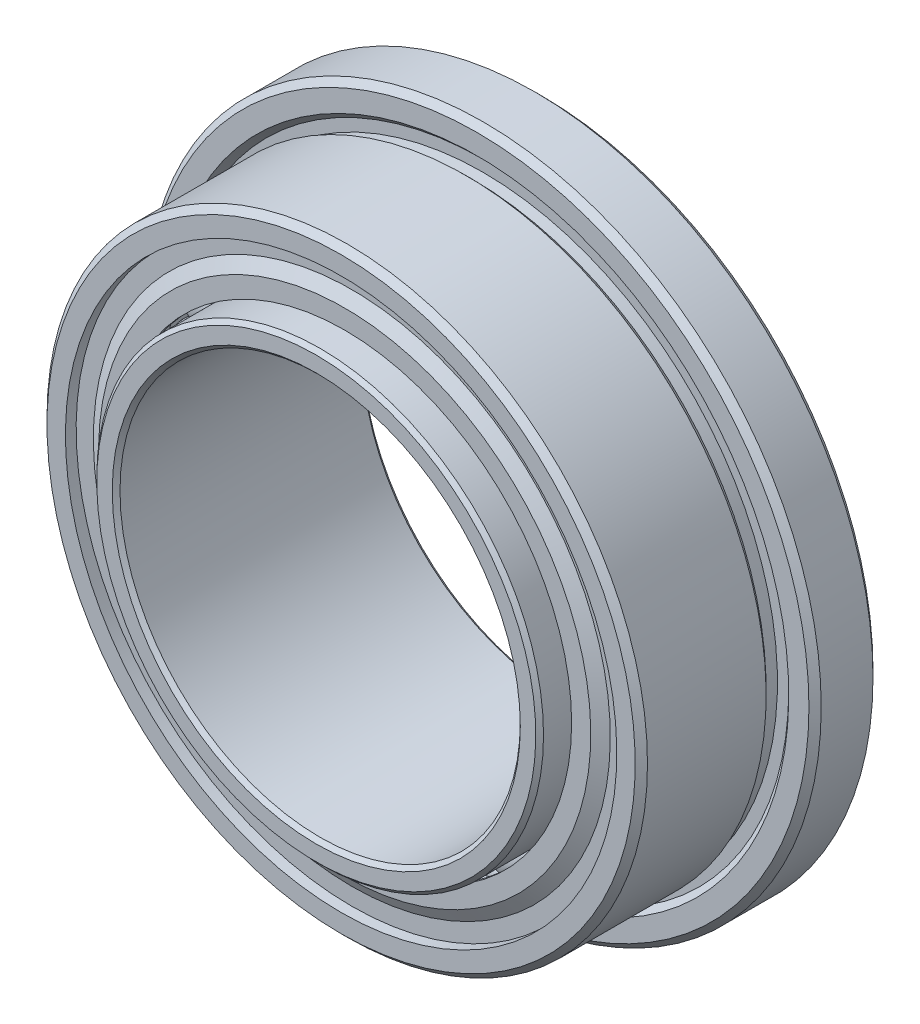
from build123d import *

# Parameters (mm, degrees)
FILLET1_SIZE      = 0.097366667
FILLET2_SIZE      = 0.061383333
CIRPATTERN3_COUNT = 27
SKETCH8_W         = 0.226785714
SKETCH8_H         = 0.194733333


with BuildPart() as part:
    # Sketch2 → Revolve1 (revolve)
    with BuildSketch(Plane(origin=(0, 0, 0), x_dir=(0, 0, -1), z_dir=(1, 0, 0))):
        with BuildLine():
            Line((1.5875, 5.3594), (0.5715, 5.3594))
            Line((0.5715, 5.3594), (0.5715, 4.942105122))
            Line((0.5715, 4.942105122), (0.661302561, 4.852302561))
            Line((0.661302561, 4.852302561), (0.661302561, 4.672697439))
            Line((0.661302561, 4.672697439), (0.481697439, 4.672697439))
            Line((0.481697439, 4.672697439), (0.391894878, 4.7625))
            Line((0.391894878, 4.7625), (-1.5875, 4.7625))
            Line((-1.5875, 4.7625), (-1.5875, 4.1783))
            Line((-1.5875, 4.1783), (-0.238125, 4.1783))
            ThreePointArc((-0.238125, 4.1783), (0, 4.257675), (0.238125, 4.1783))
            Line((0.238125, 4.1783), (1.5875, 4.1783))
            Line((1.5875, 4.1783), (1.5875, 5.3594))
        make_face()
        with BuildLine():
            Line((1.9812, 3.175), (-1.9812, 3.175))
            Line((-1.9812, 3.175), (-1.9812, 3.5433))
            Line((-1.9812, 3.5433), (-0.238125, 3.5433))
            ThreePointArc((-0.238125, 3.5433), (0, 3.463925), (0.238125, 3.5433))
            Line((0.238125, 3.5433), (1.9812, 3.5433))
            Line((1.9812, 3.5433), (1.9812, 3.175))
        make_face()
    revolve(axis=Axis((0, 0, 0), (0, 0, -1)))

    # Fillet1
    fillet1_edges = [part.edges().sort_by_distance(p)[0] for p in [
        (0, -5.3594, -1.5875),
        (0, -5.3594, -0.5715),
        (0, -4.7625, 1.5875),
    ]]
    chamfer(fillet1_edges, length=FILLET1_SIZE)

    # Fillet2
    fillet2_edges = [part.edges().sort_by_distance(p)[0] for p in [
        (0, -3.5433, -1.9812),
        (0, -3.175, -1.9812),
        (0, -3.5433, 1.9812),
        (0, -3.175, 1.9812),
    ]]
    chamfer(fillet2_edges, length=FILLET2_SIZE)

    # Sketch8 → Cut-Revolve1 (revolve, cut)
    with BuildSketch(Plane(origin=(0, 0, 0), x_dir=(0, 0, -1), z_dir=(1, 0, 0))):
        with Locations((-1.474107143, 4.275666667)):
            Rectangle(SKETCH8_W, SKETCH8_H)
        with Locations((1.474107143, 4.275666667)):
            Rectangle(SKETCH8_W, SKETCH8_H)
    revolve(axis=Axis((0, 0, 0), (0, 0, -1)), mode=Mode.SUBTRACT)


with BuildPart() as body_2:
    # Sketch7 → Revolve3 (revolve)
    with BuildSketch(Plane.XY):
        with BuildLine():
            Line((0, 4.257675), (0, 3.463925))
            ThreePointArc((0, 3.463925), (-0.396875, 3.8608), (0, 4.257675))
        make_face()
    revolve(axis=Axis((0, 4.257675, 0), (0, -1, 0)))


with BuildPart() as cirpattern3_1:
    # CirPattern3: pattern copy
    add(body_2.part.rotate(Axis((0, 0, 0), (0, 0, -1)), 1 * 360 / CIRPATTERN3_COUNT))


with BuildPart() as cirpattern3_2:
    # CirPattern3: pattern copy
    add(body_2.part.rotate(Axis((0, 0, 0), (0, 0, -1)), 2 * 360 / CIRPATTERN3_COUNT))


with BuildPart() as cirpattern3_3:
    # CirPattern3: pattern copy
    add(body_2.part.rotate(Axis((0, 0, 0), (0, 0, -1)), 3 * 360 / CIRPATTERN3_COUNT))


with BuildPart() as cirpattern3_4:
    # CirPattern3: pattern copy
    add(body_2.part.rotate(Axis((0, 0, 0), (0, 0, -1)), 4 * 360 / CIRPATTERN3_COUNT))


with BuildPart() as cirpattern3_5:
    # CirPattern3: pattern copy
    add(body_2.part.rotate(Axis((0, 0, 0), (0, 0, -1)), 5 * 360 / CIRPATTERN3_COUNT))


with BuildPart() as cirpattern3_6:
    # CirPattern3: pattern copy
    add(body_2.part.rotate(Axis((0, 0, 0), (0, 0, -1)), 6 * 360 / CIRPATTERN3_COUNT))


with BuildPart() as cirpattern3_7:
    # CirPattern3: pattern copy
    add(body_2.part.rotate(Axis((0, 0, 0), (0, 0, -1)), 7 * 360 / CIRPATTERN3_COUNT))


with BuildPart() as cirpattern3_8:
    # CirPattern3: pattern copy
    add(body_2.part.rotate(Axis((0, 0, 0), (0, 0, -1)), 8 * 360 / CIRPATTERN3_COUNT))


with BuildPart() as cirpattern3_9:
    # CirPattern3: pattern copy
    add(body_2.part.rotate(Axis((0, 0, 0), (0, 0, -1)), 9 * 360 / CIRPATTERN3_COUNT))


with BuildPart() as cirpattern3_10:
    # CirPattern3: pattern copy
    add(body_2.part.rotate(Axis((0, 0, 0), (0, 0, -1)), 10 * 360 / CIRPATTERN3_COUNT))


with BuildPart() as cirpattern3_11:
    # CirPattern3: pattern copy
    add(body_2.part.rotate(Axis((0, 0, 0), (0, 0, -1)), 11 * 360 / CIRPATTERN3_COUNT))


with BuildPart() as cirpattern3_12:
    # CirPattern3: pattern copy
    add(body_2.part.rotate(Axis((0, 0, 0), (0, 0, -1)), 12 * 360 / CIRPATTERN3_COUNT))


with BuildPart() as cirpattern3_13:
    # CirPattern3: pattern copy
    add(body_2.part.rotate(Axis((0, 0, 0), (0, 0, -1)), 13 * 360 / CIRPATTERN3_COUNT))


with BuildPart() as cirpattern3_14:
    # CirPattern3: pattern copy
    add(body_2.part.rotate(Axis((0, 0, 0), (0, 0, -1)), 14 * 360 / CIRPATTERN3_COUNT))


with BuildPart() as cirpattern3_15:
    # CirPattern3: pattern copy
    add(body_2.part.rotate(Axis((0, 0, 0), (0, 0, -1)), 15 * 360 / CIRPATTERN3_COUNT))


with BuildPart() as cirpattern3_16:
    # CirPattern3: pattern copy
    add(body_2.part.rotate(Axis((0, 0, 0), (0, 0, -1)), 16 * 360 / CIRPATTERN3_COUNT))


with BuildPart() as cirpattern3_17:
    # CirPattern3: pattern copy
    add(body_2.part.rotate(Axis((0, 0, 0), (0, 0, -1)), 17 * 360 / CIRPATTERN3_COUNT))


with BuildPart() as cirpattern3_18:
    # CirPattern3: pattern copy
    add(body_2.part.rotate(Axis((0, 0, 0), (0, 0, -1)), 18 * 360 / CIRPATTERN3_COUNT))


with BuildPart() as cirpattern3_19:
    # CirPattern3: pattern copy
    add(body_2.part.rotate(Axis((0, 0, 0), (0, 0, -1)), 19 * 360 / CIRPATTERN3_COUNT))


with BuildPart() as cirpattern3_20:
    # CirPattern3: pattern copy
    add(body_2.part.rotate(Axis((0, 0, 0), (0, 0, -1)), 20 * 360 / CIRPATTERN3_COUNT))


with BuildPart() as cirpattern3_21:
    # CirPattern3: pattern copy
    add(body_2.part.rotate(Axis((0, 0, 0), (0, 0, -1)), 21 * 360 / CIRPATTERN3_COUNT))


with BuildPart() as cirpattern3_22:
    # CirPattern3: pattern copy
    add(body_2.part.rotate(Axis((0, 0, 0), (0, 0, -1)), 22 * 360 / CIRPATTERN3_COUNT))


with BuildPart() as cirpattern3_23:
    # CirPattern3: pattern copy
    add(body_2.part.rotate(Axis((0, 0, 0), (0, 0, -1)), 23 * 360 / CIRPATTERN3_COUNT))


with BuildPart() as cirpattern3_24:
    # CirPattern3: pattern copy
    add(body_2.part.rotate(Axis((0, 0, 0), (0, 0, -1)), 24 * 360 / CIRPATTERN3_COUNT))


with BuildPart() as cirpattern3_25:
    # CirPattern3: pattern copy
    add(body_2.part.rotate(Axis((0, 0, 0), (0, 0, -1)), 25 * 360 / CIRPATTERN3_COUNT))


with BuildPart() as cirpattern3_26:
    # CirPattern3: pattern copy
    add(body_2.part.rotate(Axis((0, 0, 0), (0, 0, -1)), 26 * 360 / CIRPATTERN3_COUNT))


with BuildPart() as body_29:
    # Sketch9 → Revolve4 (revolve)
    with BuildSketch(Plane(origin=(0, 0, 0), x_dir=(0, 0, -1), z_dir=(1, 0, 0))):
        Polygon((-1.360714286, 4.373033333), (-1.360714286, 4.084715976), (-1.474107143, 3.888313786), (-1.474107143, 3.599996429), (-1.530803571, 3.599996429), (-1.530803571, 3.903505548), (-1.417410714, 4.099907738), (-1.417410714, 4.373033333), align=None)
        Polygon((1.360714286, 4.373033333), (1.360714286, 4.084715976), (1.474107143, 3.888313786), (1.474107143, 3.599996429), (1.530803571, 3.599996429), (1.530803571, 3.903505548), (1.417410714, 4.099907738), (1.417410714, 4.373033333), align=None)
    revolve(axis=Axis((0, 0, 0), (0, 0, -1)))


solid = Compound([part.part, body_2.part, cirpattern3_1.part, cirpattern3_2.part, cirpattern3_3.part, cirpattern3_4.part, cirpattern3_5.part, cirpattern3_6.part, cirpattern3_7.part, cirpattern3_8.part, cirpattern3_9.part, cirpattern3_10.part, cirpattern3_11.part, cirpattern3_12.part, cirpattern3_13.part, cirpattern3_14.part, cirpattern3_15.part, cirpattern3_16.part, cirpattern3_17.part, cirpattern3_18.part, cirpattern3_19.part, cirpattern3_20.part, cirpattern3_21.part, cirpattern3_22.part, cirpattern3_23.part, cirpattern3_24.part, cirpattern3_25.part, cirpattern3_26.part, body_29.part])
